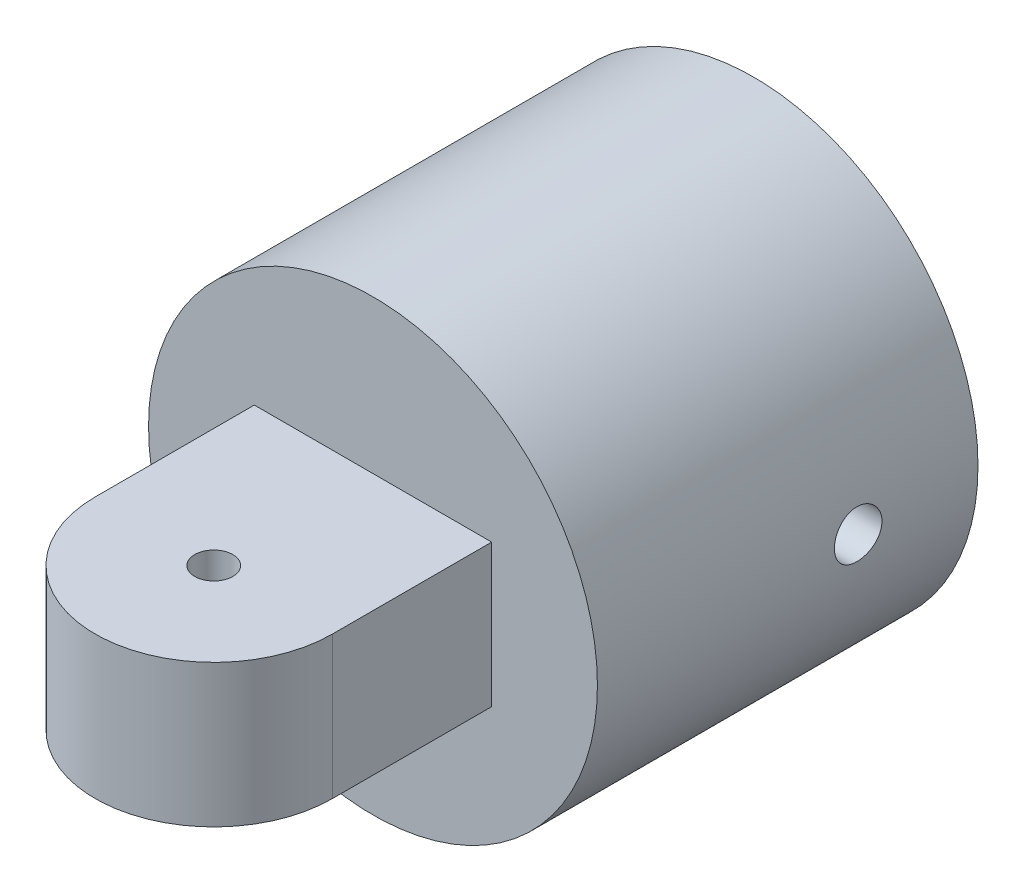
from build123d import *

# Parameters (mm, degrees)
RESSALTO_EXTRUS_O1_DEPTH      = 30
RESSALTO_EXTRUS_O1_DEPTH_BACK = 10
ESBO_O1_R                     = 23.59
RESSALTO_EXTRUS_O2_DEPTH      = 7.49
ESBO_O3_R                     = 2
CORTE_EXTRUS_O1_DEPTH         = 37.5
ESBO_O4_R                     = 2.5
CORTE_EXTRUS_O2_DEPTH         = 80


with BuildPart() as part:
    # Esboço1 → Ressalto-extrusão1 (new, two sides: drawn at the far end of the back side and taken through both)
    with BuildSketch(Plane.XY.offset(-RESSALTO_EXTRUS_O1_DEPTH_BACK)):
        Circle(ESBO_O1_R)
    extrude(amount=RESSALTO_EXTRUS_O1_DEPTH + RESSALTO_EXTRUS_O1_DEPTH_BACK)

    # Esboço4 → Corte-extrusão2 (cut, symmetric)
    with BuildSketch(Plane.ZY.offset(22.473507345)):
        with Locations((2.59265528, 0)):
            Circle(ESBO_O4_R)
    extrude(amount=CORTE_EXTRUS_O2_DEPTH, both=True, mode=Mode.SUBTRACT)


with BuildPart() as body_2:
    # Esboço2 → Ressalto-extrusão2 (new, symmetric)
    with BuildSketch(Plane(origin=(0, 0, 0), x_dir=(1, 0, 0), z_dir=(0, 1, 0))):
        with BuildLine():
            Line((-12.473507345, -30), (12.473507345, -30))
            Line((12.473507345, -30), (12.473507345, -46.734725635))
            ThreePointArc((12.473507345, -46.734725635), (0, -59.20823298), (-12.473507345, -46.734725635))
            Line((-12.473507345, -46.734725635), (-12.473507345, -30))
        make_face()
    extrude(amount=RESSALTO_EXTRUS_O2_DEPTH, both=True)

    # Esboço3 → Corte-extrusão1 (cut, symmetric)
    with BuildSketch(Plane(origin=(0, 7.49, 0), x_dir=(1, 0, 0), z_dir=(0, 1, 0))):
        with Locations((0, -46.734725635)):
            Circle(ESBO_O3_R)
    extrude(amount=CORTE_EXTRUS_O1_DEPTH, both=True, mode=Mode.SUBTRACT)


solid = Compound([part.part, body_2.part])
